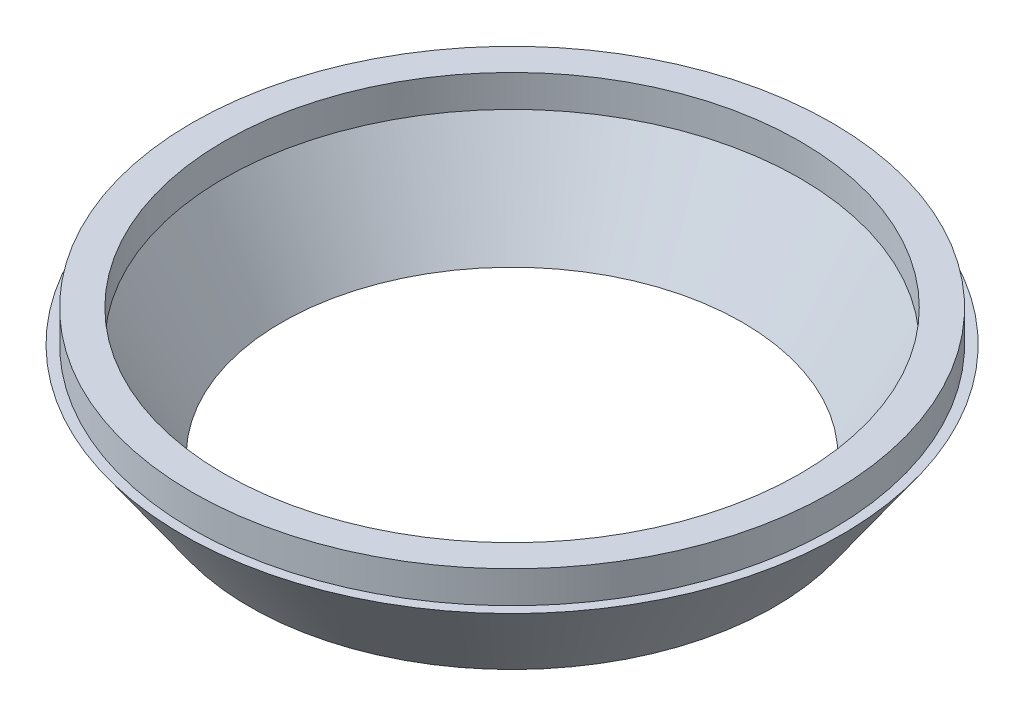
from build123d import *

# Parameters (mm, degrees)
SKETCH3_R           = 63.5
SKETCH3_R_2         = 57.15
BOSS_EXTRUDE1_DEPTH = 6.35


with BuildPart() as part:
    # Sketch2 → Revolve1 (revolve)
    with BuildSketch(Plane.XY):
        Polygon((-45.72, 0), (-52.07, 0), (-65.405, 19.05), (-57.15, 19.05), align=None)
    revolve(axis=Axis((0, 0, 0), (0, 1, 0)))

    # Sketch3 → Boss-Extrude1 (add)
    with BuildSketch(Plane(origin=(0, 19.05, 0), x_dir=(1, 0, 0), z_dir=(0, 1, 0))):
        Circle(SKETCH3_R)
        Circle(SKETCH3_R_2, mode=Mode.SUBTRACT)
    extrude(amount=BOSS_EXTRUDE1_DEPTH)


solid = part.part
